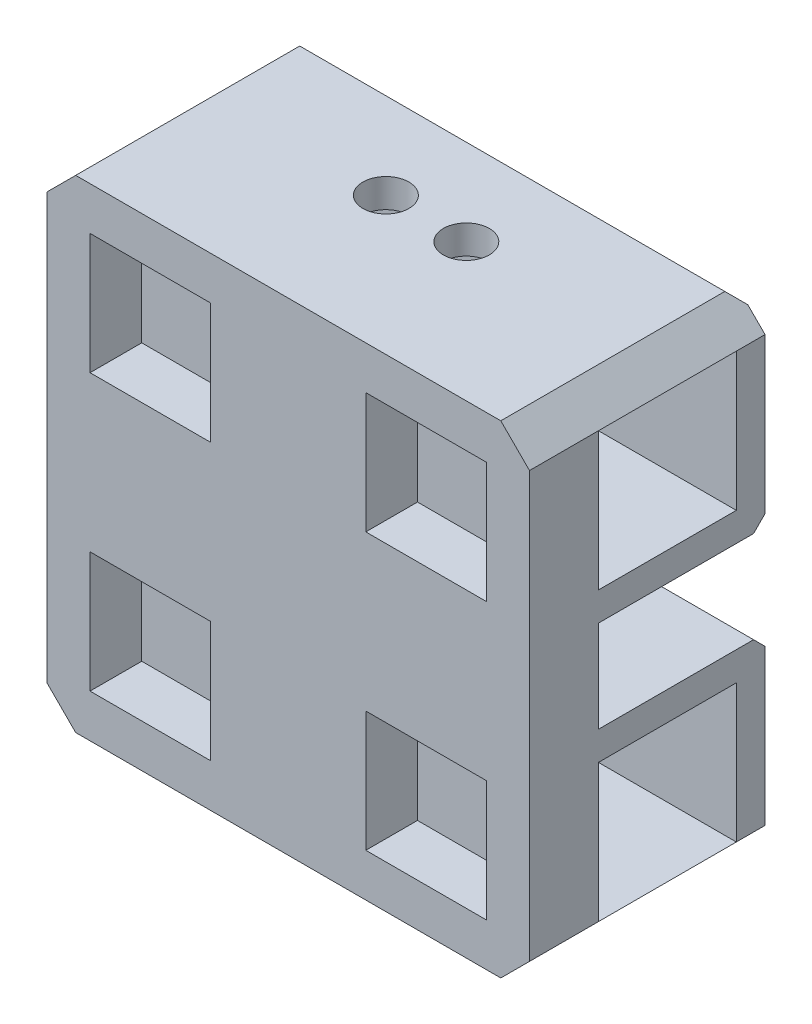
from build123d import *

# Parameters (mm, degrees)
ESQUISSE1_W               = 42
ESQUISSE1_H               = 42
BOSS_EXTRU_1_DEPTH        = 6
ESQUISSE2_W               = 42
ESQUISSE2_H               = 17
BOSS_EXTRU_3_DEPTH        = 14.5
ESQUISSE3_W               = 12
ESQUISSE3_H               = 12
ENL_V_MAT_EXTRU_3_DEPTH   = 62.141229952
ESQUISSE4_R               = 2
ENL_V_MAT_EXTRU_4_DEPTH   = 42
CHANFREIN1_SIZE           = 2.5
ESQUISSE5_W               = 10.5
ESQUISSE5_H               = 10.5
ENL_V_MAT_EXTRU_5_DEPTH   = 4.5
SYM_TRIE3_COPY_1_SKETCH_W = 10.5
SYM_TRIE3_COPY_1_SKETCH_H = 10.5
SYM_TRIE3_COPY_1_DEPTH    = 4.5
CHANFREIN2_SIZE           = 1


with BuildPart() as part:
    # Esquisse1 → Boss.-Extru.1 (new body)
    with BuildSketch(Plane.XY):
        with Locations((21, -21)):
            Rectangle(ESQUISSE1_W, ESQUISSE1_H)
    extrude(amount=BOSS_EXTRU_1_DEPTH)

    # Esquisse2 → Boss.-Extru.3 (add)
    with BuildSketch(Plane(origin=(0, 0, 0), x_dir=(-1, 0, 0), z_dir=(0, 0, -1))):
        with Locations((-21, -33.5)):
            Rectangle(ESQUISSE2_W, ESQUISSE2_H)
    boss_extru_3 = extrude(amount=BOSS_EXTRU_3_DEPTH)

    # Esquisse3 → Enlèv. mat.-Extru.3 (cut, through all)
    with BuildSketch(Plane(origin=(42, 0, 0), x_dir=(0, 0, -1), z_dir=(1, 0, 0))):
        with Locations((6, -33.5)):
            Rectangle(ESQUISSE3_W, ESQUISSE3_H)
    enl_v_mat_extru_3 = extrude(amount=-ENL_V_MAT_EXTRU_3_DEPTH, mode=Mode.SUBTRACT)

    # Symétrie1: Boss.-Extru.3, Enlèv. mat.-Extru.3 across plane
    add(boss_extru_3.mirror(Plane(origin=(0, -21, 0), x_dir=(0, 0, 1), z_dir=(0, -1, 0))))
    add(enl_v_mat_extru_3.mirror(Plane(origin=(0, -21, 0), x_dir=(0, 0, 1), z_dir=(0, -1, 0))), mode=Mode.SUBTRACT)

    # Esquisse4 → Enlèv. mat.-Extru.4 (cut)
    with BuildSketch(Plane.XZ.offset(42)):
        with Locations(Location((24.5, -6, 0), (0, 0, 270))):
            Circle(ESQUISSE4_R)
        with Locations(Location((17.5, -6, 0), (0, 0, 270))):
            Circle(ESQUISSE4_R)
    extrude(amount=-ENL_V_MAT_EXTRU_4_DEPTH, mode=Mode.SUBTRACT)

    # Chanfrein1
    chanfrein1_edges = [part.edges().sort_by_distance(p)[0] for p in [
        (42, -42, -4.25),
        (0, -42, -4.25),
        (0, 0, -4.25),
        (42, 0, -4.25),
    ]]
    chamfer(chanfrein1_edges, length=CHANFREIN1_SIZE - 0.0001)  # a hair under: the kernel refuses the full size

    # Esquisse5 → Enlèv. mat.-Extru.5 (cut)
    with BuildSketch(Plane.XY.offset(6)):
        with Locations((9, -9)):
            Rectangle(ESQUISSE5_W, ESQUISSE5_H)
    enl_v_mat_extru_5 = extrude(amount=-ENL_V_MAT_EXTRU_5_DEPTH, mode=Mode.SUBTRACT)

    # Symétrie2: Enlèv. mat.-Extru.5 across plane
    add(enl_v_mat_extru_5.mirror(Plane.ZY.offset(-21)), mode=Mode.SUBTRACT)

    # Symétrie3: Enlèv. mat.-Extru.5 across plane
    add(enl_v_mat_extru_5.mirror(Plane(origin=(0, -21, 0), x_dir=(0, 0, 1), z_dir=(0, -1, 0))), mode=Mode.SUBTRACT)

    # Symétrie3 copy 1 sketch → Symétrie3 copy 1 (cut)
    with BuildSketch(Plane(origin=(42, -42, 6), x_dir=(-1, 0, 0), z_dir=(0, 0, 1))):
        with Locations((9, -9)):
            Rectangle(SYM_TRIE3_COPY_1_SKETCH_W, SYM_TRIE3_COPY_1_SKETCH_H)
    extrude(amount=-SYM_TRIE3_COPY_1_DEPTH, mode=Mode.SUBTRACT)

    # Chanfrein2
    chanfrein2_edges = [part.edges().sort_by_distance(p)[0] for p in [
        (21, 0, -14.5),
        (21, -42, -14.5),
        (21, -25, -14.5),
        (21, -17, -14.5),
    ]]
    chamfer(chanfrein2_edges, length=CHANFREIN2_SIZE)


solid = part.part
